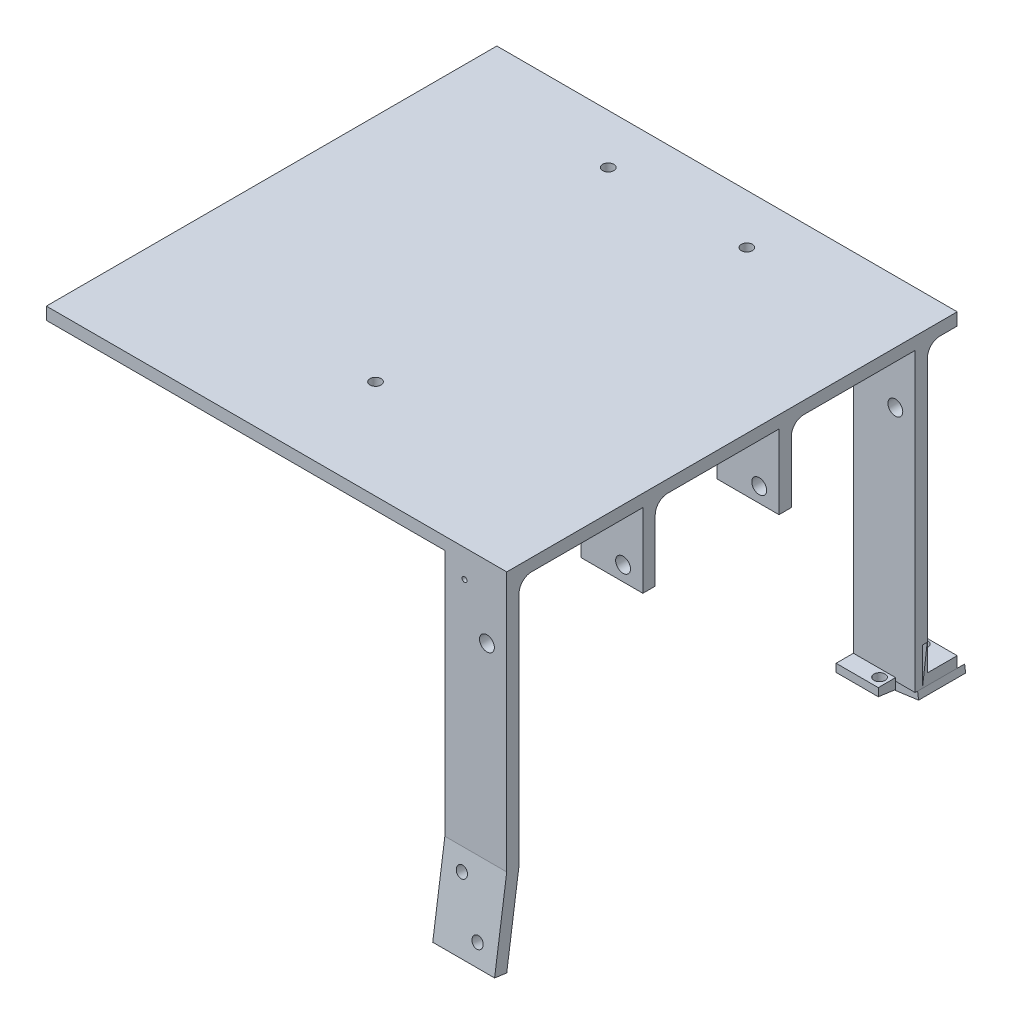
from build123d import *

# Parameters (mm, degrees)
BOSS_EXTRUDE1_DEPTH      = 5
SKETCH2_W                = 5
SKETCH2_H                = 22.5
BOSS_EXTRUDE2_DEPTH      = 38
SKETCH5_W                = 25
SKETCH5_H                = 5
BOSS_EXTRUDE3_DEPTH      = 30
FILLET3_R                = 5
SKETCH6_R                = 3
CUT_EXTRUDE4_DEPTH       = 172
SKETCH7_W                = 5
SKETCH7_H                = 22.5
BOSS_EXTRUDE4_DEPTH      = 51.5
SKETCH3_R                = 1.3
CUT_EXTRUDE2_DEPTH       = 357.71872673
SKETCH9_W                = 116
SKETCH9_H                = 63.779574991
CUT_EXTRUDE6_DEPTH       = 10
SKETCH10_W               = 25
SKETCH10_H               = 5
BOSS_EXTRUDE5_DEPTH      = 70
BOSS_EXTRUDE6_DEPTH      = 25
SKETCH12_W               = 25
SKETCH12_H               = 5
BOSS_EXTRUDE7_DEPTH      = 19.72
BOSS_EXTRUDE8_DEPTH      = 15
BOSS_EXTRUDE8_DEPTH_BACK = 4
CUT_EXTRUDE7_DEPTH       = 15
SKETCH15_R               = 2.25
CUT_EXTRUDE8_DEPTH       = 20
SKETCH16_W               = 6
SKETCH16_H               = 3
BOSS_EXTRUDE9_DEPTH      = 12.4
SKETCH17_R               = 1
CUT_EXTRUDE9_DEPTH       = 282.347152812
SKETCH27_W               = 25.232191294
SKETCH27_H               = 19
BOSS_EXTRUDE11_DEPTH     = 3
FILLET4_R                = 5
SKETCH18_R               = 2.25
CUT_EXTRUDE10_DEPTH      = 378.078044336
SKETCH19_W               = 4.5
SKETCH19_H               = 6
CUT_EXTRUDE12_DEPTH      = 383.13686347
FILLET6_R                = 10
SKETCH21_W               = 27
SKETCH21_H               = 70
CUT_EXTRUDE14_DEPTH      = 383.13686347
FILLET7_R                = 10
FILLET8_R                = 2.5
SKETCH22_R               = 2.25
CUT_EXTRUDE16_DEPTH      = 10
SKETCH23_W               = 17.043474802
SKETCH23_H               = 5.138762975
BOSS_EXTRUDE10_DEPTH     = 7
CUT_EXTRUDE17_REACH      = 372.436
CUT_EXTRUDE18_REACH      = 380.086
SKETCH25_R               = 2.25
SKETCH28_R               = 2.25
CUT_EXTRUDE19_DEPTH      = 384.936136276
CUT_EXTRUDE20_DEPTH      = 126
CUT_EXTRUDE20_DEPTH_BACK = 10
SKETCH29_W               = 186
SKETCH29_H               = 118
SKETCH30_R               = 2.25
CUT_EXTRUDE21_DEPTH      = 383.13686347


with BuildPart() as part:
    # Sketch1 → Boss-Extrude1 (new body)
    with BuildSketch(Plane(origin=(0, 0, 0), x_dir=(1, 0, 0), z_dir=(0, 1, 0))):
        Polygon((0, 0), (0, -300), (186, -300), (186, 0), (176, 0), (151, 0), (151, -56.115865257), (35, -56.115865257), (35, 0), (10, 0), align=None)
    extrude(amount=BOSS_EXTRUDE1_DEPTH)

    # Sketch2 → Boss-Extrude2 (add)
    with BuildSketch(Plane.XZ):
        with Locations((53, 82.75)):
            Rectangle(SKETCH2_W, SKETCH2_H)
        with Locations((133, 82.75)):
            Rectangle(SKETCH2_W, SKETCH2_H)
    extrude(amount=BOSS_EXTRUDE2_DEPTH)

    # Sketch5 → Boss-Extrude3 (add)
    with BuildSketch(Plane.XZ):
        with Locations((173.5, 297.5)):
            Rectangle(SKETCH5_W, SKETCH5_H)
        with Locations((173.5, 242.5)):
            Rectangle(SKETCH5_W, SKETCH5_H)
        with Locations((173.5, 187.5)):
            Rectangle(SKETCH5_W, SKETCH5_H)
        with Locations((173.5, 132.5)):
            Rectangle(SKETCH5_W, SKETCH5_H)
    extrude(amount=BOSS_EXTRUDE3_DEPTH)

    # Fillet3
    fillet3_edges = [part.edges().sort_by_distance(p)[0] for p in [
        (173.5, 0, 130),
        (173.5, 0, 185),
        (173.5, 0, 240),
        (173.5, 0, 295),
    ]]
    fillet(fillet3_edges, radius=FILLET3_R)

    # Sketch6 → Cut-Extrude4 (cut)
    with BuildSketch(Plane.XY.offset(300)):
        with Locations((178, -24)):
            Circle(SKETCH6_R)
    extrude(amount=-CUT_EXTRUDE4_DEPTH, mode=Mode.SUBTRACT)

    # Sketch7 → Boss-Extrude4 (add)
    with BuildSketch(Plane.XZ):
        with Locations((2.5, 11.25)):
            Rectangle(SKETCH7_W, SKETCH7_H)
        with Locations((183.5, 11.25)):
            Rectangle(SKETCH7_W, SKETCH7_H)
    extrude(amount=BOSS_EXTRUDE4_DEPTH)

    # Sketch3 → Cut-Extrude2 (cut, through all)
    with BuildSketch(Plane(origin=(186, 0, 0), x_dir=(0, 0, -1), z_dir=(1, 0, 0))):
        with Locations((-74, -32.9)):
            Circle(SKETCH3_R)
        with Locations((-91.5, -32.9)):
            Circle(SKETCH3_R)
        with Locations((-20, -46.4)):
            Circle(SKETCH3_R)
        with Locations((-2.5, -46.4)):
            Circle(SKETCH3_R)
    extrude(amount=-CUT_EXTRUDE2_DEPTH, mode=Mode.SUBTRACT)

    # Sketch9 → Cut-Extrude6 (cut)
    with BuildSketch(Plane.XZ):
        with Locations((93, 31.889787496)):
            Rectangle(SKETCH9_W, SKETCH9_H)
    extrude(amount=-CUT_EXTRUDE6_DEPTH, mode=Mode.SUBTRACT)

    # Sketch10 → Boss-Extrude5 (add)
    with BuildSketch(Plane.XZ.offset(30)):
        with Locations((173.5, 297.5)):
            Rectangle(SKETCH10_W, SKETCH10_H)
        with Locations((173.5, 132.5)):
            Rectangle(SKETCH10_W, SKETCH10_H)
    extrude(amount=BOSS_EXTRUDE5_DEPTH)

    # Sketch11 → Boss-Extrude6 (add)
    with BuildSketch(Plane(origin=(186, 0, 0), x_dir=(0, 0, -1), z_dir=(1, 0, 0))):
        Polygon((-300, -100), (-304.901863346, -134.643852153), (-300, -135.337431613), (-295, -100), align=None)
    extrude(amount=-BOSS_EXTRUDE6_DEPTH)

    # Sketch12 → Boss-Extrude7 (add)
    with BuildSketch(Plane.XZ.offset(100)):
        with Locations((173.5, 132.5)):
            Rectangle(SKETCH12_W, SKETCH12_H)
    extrude(amount=BOSS_EXTRUDE7_DEPTH)

    # Sketch13 → Boss-Extrude8 (add, two sides: drawn at the far end of the back side and taken through both)
    with BuildSketch(Plane(origin=(0, 0, 130), x_dir=(-1, 0, 0), z_dir=(0, 0, -1)).offset(-BOSS_EXTRUDE8_DEPTH_BACK)):
        Polygon((-186, -115.314128401), (-186, -119.72), (-161, -123.135183378), (-161, -115.314128401), align=None)
    extrude(amount=BOSS_EXTRUDE8_DEPTH + BOSS_EXTRUDE8_DEPTH_BACK)

    # Sketch14 → Cut-Extrude7 (cut)
    with BuildSketch(Plane(origin=(19.462480736, -142.470246704, 0), x_dir=(0.9907978149243063, 0.1353502491361595, 0), z_dir=(0.1353502491361595, -0.9907978149243063, 0))):
        Polygon((186.357631366, 115), (168.084261749, 132.037436989), (198.015187573, 130.430954629), (197.515117956, 111.366582762), (186.357631366, 109.607523038), align=None)
    extrude(amount=-CUT_EXTRUDE7_DEPTH, mode=Mode.SUBTRACT)

    # Sketch15 → Cut-Extrude8 (cut)
    with BuildSketch(Plane(origin=(0, 39.65203451, 280.240211564), x_dir=(1, 0, 0), z_dir=(0, 0.14009757598944012, 0.9901377021414158))):
        with Locations((178, -168.031966348)):
            Circle(SKETCH15_R)
        with Locations((169, -149.043043011)):
            Circle(SKETCH15_R)
    extrude(amount=-CUT_EXTRUDE8_DEPTH, mode=Mode.SUBTRACT)

    # Sketch16 → Boss-Extrude9 (add)
    with BuildSketch(Plane.XZ):
        with Locations((169, 273.5)):
            Rectangle(SKETCH16_W, SKETCH16_H)
        with Locations((140.4, 273.5)):
            Rectangle(SKETCH16_W, SKETCH16_H)
        with Locations((169, 218.5)):
            Rectangle(SKETCH16_W, SKETCH16_H)
        with Locations((169, 163.5)):
            Rectangle(SKETCH16_W, SKETCH16_H)
        with Locations((140.4, 218.5)):
            Rectangle(SKETCH16_W, SKETCH16_H)
        with Locations((140.4, 163.5)):
            Rectangle(SKETCH16_W, SKETCH16_H)
    extrude(amount=BOSS_EXTRUDE9_DEPTH)

    # Sketch17 → Cut-Extrude9 (cut, through all)
    with BuildSketch(Plane(origin=(0, 0, 162), x_dir=(-1, 0, 0), z_dir=(0, 0, -1))):
        with Locations((-168.95, -6.2)):
            Circle(SKETCH17_R)
        with Locations((-140.45, -6.2)):
            Circle(SKETCH17_R)
    extrude(amount=-CUT_EXTRUDE9_DEPTH, mode=Mode.SUBTRACT)

    # Sketch27 → Boss-Extrude11 (add)
    with BuildSketch(Plane(origin=(19.462480736, -142.470246704, 0), x_dir=(0.9907978149243063, 0.1353502491361595, 0), z_dir=(0.1353502491361595, -0.9907978149243063, 0))):
        with Locations((155.468166102, 124.5)):
            Rectangle(SKETCH27_W, SKETCH27_H)
    extrude(amount=BOSS_EXTRUDE11_DEPTH)

    # Fillet4
    fillet4_edges = [part.edges().sort_by_distance(p)[0] for p in [
        (140.4, 0, 275),
        (169, 0, 275),
        (140.4, 0, 220),
        (169, 0, 220),
        (140.4, 0, 165),
        (169, 0, 165),
    ]]
    fillet(fillet4_edges, radius=FILLET4_R)

    # Sketch18 → Cut-Extrude10 (cut, through all)
    with BuildSketch(Plane(origin=(0, -115.314128401, 0), x_dir=(1, 0, 0), z_dir=(0, 1, 0))):
        with Locations((174.885718372, -120.99470656)):
            Circle(SKETCH18_R)
    extrude(amount=-CUT_EXTRUDE10_DEPTH, mode=Mode.SUBTRACT)

    # Sketch19 → Cut-Extrude12 (cut, through all)
    with BuildSketch(Plane.XZ):
        with Locations((41.05, 82.75)):
            Rectangle(SKETCH19_W, SKETCH19_H)
        with Locations((144.95, 82.75)):
            Rectangle(SKETCH19_W, SKETCH19_H)
    extrude(amount=-CUT_EXTRUDE12_DEPTH, mode=Mode.SUBTRACT)

    # Fillet6
    fillet6_edges = [part.edges().sort_by_distance(p)[0] for p in [
        (151, 2.5, 63.779574991),
        (35, 2.5, 63.779574991),
    ]]
    fillet(fillet6_edges, radius=FILLET6_R)

    # Sketch21 → Cut-Extrude14 (cut, through all)
    with BuildSketch(Plane.XZ):
        with Locations((13.5, 83)):
            Rectangle(SKETCH21_W, SKETCH21_H)
        with Locations((172.5, 83)):
            Rectangle(SKETCH21_W, SKETCH21_H)
    extrude(amount=-CUT_EXTRUDE14_DEPTH, mode=Mode.SUBTRACT)

    # Fillet7
    fillet7_edges = [part.edges().sort_by_distance(p)[0] for p in [
        (27, 2.5, 118),
        (27, 2.5, 48),
        (159, 2.5, 48),
        (159, 2.5, 118),
    ]]
    fillet(fillet7_edges, radius=FILLET7_R)

    # Fillet8
    fillet8_edges = [part.edges().sort_by_distance(p)[0] for p in [
        (55.5, 0, 82.75),
        (130.5, 0, 82.75),
    ]]
    fillet(fillet8_edges, radius=FILLET8_R)

    # Sketch22 → Cut-Extrude16 (cut)
    with BuildSketch(Plane.XZ):
        with Locations((115, 72.25)):
            Circle(SKETCH22_R)
        with Locations((71, 72.25)):
            Circle(SKETCH22_R)
        with Locations((24.5, 25.25)):
            Circle(SKETCH22_R)
        with Locations((161.5, 25.617459027)):
            Circle(SKETCH22_R)
    extrude(amount=-CUT_EXTRUDE16_DEPTH, mode=Mode.SUBTRACT)

    # Sketch23 → Boss-Extrude10 (add)
    with BuildSketch(Plane.XY.offset(135)):
        with Locations((169.584553608, -121.006176699)):
            Rectangle(SKETCH23_W, SKETCH23_H)
    extrude(amount=BOSS_EXTRUDE10_DEPTH)

    # Sketch24 → Cut-Extrude17 (cut, up to next)
    with BuildSketch(Plane.ZY.offset(-161.062816207), mode=Mode.PRIVATE) as cut_extrude17_sk1:
        Polygon((142, -121.648432415), (135, -122.638883571), (134.714975443, -124.33810847), (142, -124.33810847), align=None)
    cut_extrude17_tool1 = extrude(cut_extrude17_sk1.sketch, amount=-CUT_EXTRUDE17_REACH, mode=Mode.PRIVATE) & part.part
    add(cut_extrude17_tool1.solids().sort_by_distance((161.062816, -123.230784, 138.703404))[0], mode=Mode.SUBTRACT)

    # Sketch25 → Cut-Extrude18 (cut, up to next)
    with BuildSketch(Plane(origin=(0, -118.436795211, 0), x_dir=(1, 0, 0), z_dir=(0, 1, 0)), mode=Mode.PRIVATE) as cut_extrude18_sk1:
        with Locations((174.719138996, -138.089405518)):
            Circle(SKETCH25_R)
    cut_extrude18_tool1 = extrude(cut_extrude18_sk1.sketch, amount=-CUT_EXTRUDE18_REACH, mode=Mode.PRIVATE) & part.part
    add(cut_extrude18_tool1.solids().sort_by_distance((174.719139, -118.436795, 138.089406))[0], mode=Mode.SUBTRACT)

    # Sketch28 → Cut-Extrude19 (cut, through all)
    with BuildSketch(Plane(origin=(0, 5, 0), x_dir=(1, 0, 0), z_dir=(0, 1, 0))):
        with Locations((93, -260)):
            Circle(SKETCH28_R)
    extrude(amount=-CUT_EXTRUDE19_DEPTH, mode=Mode.SUBTRACT)

    # Sketch29 → Cut-Extrude20 (cut, two sides: drawn at the far end of the back side and taken through both)
    with BuildSketch(Plane.XZ.offset(-CUT_EXTRUDE20_DEPTH_BACK)):
        with Locations((93, 59)):
            Rectangle(SKETCH29_W, SKETCH29_H)
    extrude(amount=CUT_EXTRUDE20_DEPTH + CUT_EXTRUDE20_DEPTH_BACK, mode=Mode.SUBTRACT)

    # Sketch30 → Cut-Extrude21 (cut, through all)
    with BuildSketch(Plane.XZ):
        with Locations((65, 138)):
            Circle(SKETCH30_R)
        with Locations((121, 138)):
            Circle(SKETCH30_R)
    extrude(amount=-CUT_EXTRUDE21_DEPTH, mode=Mode.SUBTRACT)


solid = part.part
